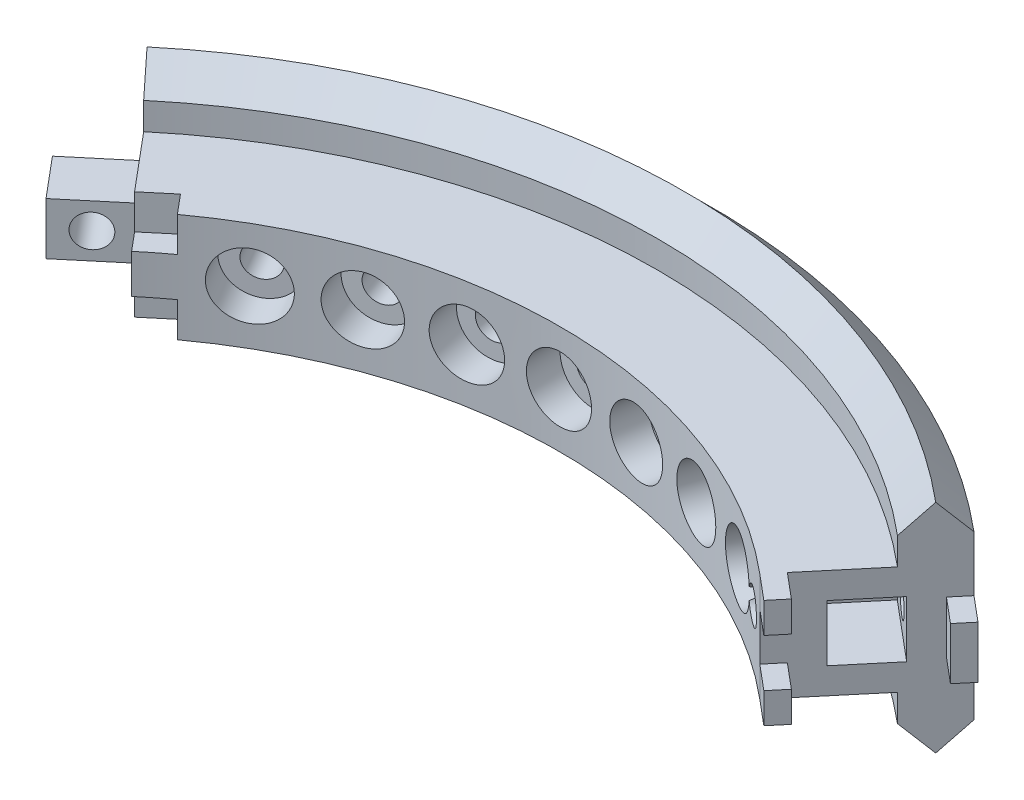
from build123d import *

# Parameters (mm, degrees)
REVOLVE_1_ANGLE          = 80
SKETCH_3_W               = 5.2
SKETCH_3_H               = 5.2
CUT_EXTRUDE_1_DEPTH      = 7
SKETCH_4_W               = 4.8
SKETCH_4_H               = 4.8
EXTRUDE_1_DEPTH          = 6
CUT_EXTRUDE_2_DEPTH      = 76.058901975
CUT_EXTRUDE_2_DEPTH_BACK = 76.058901975
SKETCH_5_R               = 1.5
CUT_EXTRUDE_START        = -1
SKETCH_6_R               = 3
CUT_EXTRUDE_3_DEPTH      = 77.259810408
SKETCH_7_R               = 1.5
CUT_EXTRUDE_4_DEPTH      = 76.587642406
SKETCH_11_R              = 1.5
CUT_EXTRUDE_6_DEPTH      = 48.784606194
CUT_EXTRUDE_7_DEPTH      = 5
SKETCH_13_W              = 3
SKETCH_13_H              = 5.021003204
PATTERN_CIRCULAR_1_COUNT = 4
PATTERN_CIRCULAR_1_ANGLE = 30
F_1_THE_OTHER_WAY_COUNT  = 4
F_1_THE_OTHER_WAY_ANGLE  = 30
SKETCH_9_W               = 1.8
SKETCH_9_H               = 4.8
SKETCH_9_H_2             = 2.8
EXTRUDE_2_DEPTH          = 3
SKETCH_10_W              = 2.2
SKETCH_10_H              = 5.2
CUT_EXTRUDE_5_DEPTH      = 3


# Read off the part's stored shape, not the designer's step: 旋转1
with BuildPart() as part:
    # 旋转1 outline → 旋转1 (revolve)
    with BuildSketch(Plane(origin=(0, 0, 0), x_dir=(0.6427876096865408, 0, -0.7660444431189768), z_dir=(0.7660444431189768, 0, 0.6427876096865408))):
        Polygon((54, 5), (45, 5), (45, -5), (54, -5), (54, -7.5), (56.5, -10), (59, -7.5), (59, 7.5), (56.5, 10), (54, 7.5), align=None)
    revolve(axis=Axis((0, 0, 0), (0, 1, 0)), revolution_arc=REVOLVE_1_ANGLE)

    # 草图3 → 切除-拉伸1 (cut)
    with BuildSketch(Plane(origin=(0, 0, 0), x_dir=(0.6427876096865405, 0, -0.766044443118977), z_dir=(0.7660444431189771, 0, 0.6427876096865406))):
        with Locations((52, 0)):
            Rectangle(SKETCH_3_W, SKETCH_3_H)
    extrude(amount=-CUT_EXTRUDE_1_DEPTH, mode=Mode.SUBTRACT)

    # 草图4 → 凸台-拉伸1 (add)
    with BuildSketch(Plane(origin=(0, 0, 0), x_dir=(0.6427876096865351, 0, 0.7660444431189817), z_dir=(-0.7660444431189817, 0, 0.6427876096865351))):
        with Locations((-52, 0)):
            Rectangle(SKETCH_4_W, SKETCH_4_H)
    extrude(amount=EXTRUDE_1_DEPTH)

    # 草图5 → 切除-拉伸2 (cut, two sides: drawn at the far end of the back side and taken through both)
    with BuildSketch(Plane(origin=(31.753707919, 0, -37.84259549), x_dir=(-0.7660444431189772, 0, -0.6427876096865404), z_dir=(0.6427876096865404, 0, -0.7660444431189772)).offset(-CUT_EXTRUDE_2_DEPTH_BACK)):
        with Locations((3.5, 0)):
            Circle(SKETCH_5_R)
    extrude(amount=CUT_EXTRUDE_2_DEPTH + CUT_EXTRUDE_2_DEPTH_BACK, mode=Mode.SUBTRACT)

    # 草图6 → 切除-拉伸3 (cut, through all)
    with BuildSketch(Plane(origin=(35.096203489, 0, -41.826026594), x_dir=(0.7660444431189772, 0, 0.6427876096865404), z_dir=(-0.6427876096865404, 0, 0.7660444431189772)).offset(CUT_EXTRUDE_START)):
        with Locations((-3.5, 0)):
            Circle(SKETCH_6_R)
    extrude(amount=-CUT_EXTRUDE_3_DEPTH, mode=Mode.SUBTRACT)

    # 草图7 → 切除-拉伸4 (cut, through all)
    with BuildSketch(Plane(origin=(-34.967645967, 0, -41.672817706), x_dir=(-0.7660444431189816, 0, 0.6427876096865353), z_dir=(-0.6427876096865353, 0, -0.7660444431189816))):
        with Locations((3, 0)):
            Circle(SKETCH_7_R)
    extrude(amount=-CUT_EXTRUDE_4_DEPTH, mode=Mode.SUBTRACT)

    # 草图11 → 切除-拉伸6 (cut, through all)
    with BuildSketch(Plane(origin=(0, 0, -59), x_dir=(-1, 0, 0), z_dir=(0, 0, -1))):
        Circle(SKETCH_11_R)
    cut_extrude_6 = extrude(amount=-CUT_EXTRUDE_6_DEPTH, mode=Mode.SUBTRACT)

    # 草图12 → 切除-拉伸7 (cut)
    with BuildSketch(Plane(origin=(0, 0, -59), x_dir=(-1, 0, 0), z_dir=(0, 0, -1))):
        Polygon((0, 3.175426481), (-2.75, 1.58771324), (-2.75, -1.58771324), (0, -3.175426481), (2.75, -1.58771324), (2.75, 1.58771324), align=None)
    cut_extrude_7 = extrude(amount=-CUT_EXTRUDE_7_DEPTH, mode=Mode.SUBTRACT)

    # 草图13 → 切除-旋转3 (revolve, cut)
    with BuildSketch(Plane(origin=(0, 0, 0), x_dir=(1, 0, 0), z_dir=(0, 1, 0)), mode=Mode.PRIVATE) as cut_revolve_3_sk:
        with Locations((1.5, 45.489498398)):
            Rectangle(SKETCH_13_W, SKETCH_13_H)
    cut_revolve_3 = revolve(cut_revolve_3_sk.sketch.rotate(Axis((0, 0, 999.855334811), (0, 0, -1)), 180), axis=Axis((0, 0, 999.855334811), (0, 0, -1)), mode=Mode.SUBTRACT)

    # 阵列(圆周)1: 切除-拉伸6, 切除-拉伸7, 切除-旋转3 ×4 about axis
    pattern_circular_1_axis = Axis((0, 0, 0), (0, 1, 0))
    add([cut_extrude_6.rotate(pattern_circular_1_axis, i * PATTERN_CIRCULAR_1_ANGLE / (PATTERN_CIRCULAR_1_COUNT - 1)) for i in range(1, PATTERN_CIRCULAR_1_COUNT)], mode=Mode.SUBTRACT)
    add([cut_extrude_7.rotate(pattern_circular_1_axis, i * PATTERN_CIRCULAR_1_ANGLE / (PATTERN_CIRCULAR_1_COUNT - 1)) for i in range(1, PATTERN_CIRCULAR_1_COUNT)], mode=Mode.SUBTRACT)
    add([cut_revolve_3.rotate(pattern_circular_1_axis, i * PATTERN_CIRCULAR_1_ANGLE / (PATTERN_CIRCULAR_1_COUNT - 1)) for i in range(1, PATTERN_CIRCULAR_1_COUNT)], mode=Mode.SUBTRACT)

    # 1 the other way: 切除-拉伸6, 切除-拉伸7, 切除-旋转3 ×4 about axis
    f_1_the_other_way_axis = Axis((0, 0, 0), (0, -1, 0))
    add([cut_extrude_6.rotate(f_1_the_other_way_axis, i * F_1_THE_OTHER_WAY_ANGLE / (F_1_THE_OTHER_WAY_COUNT - 1)) for i in range(1, F_1_THE_OTHER_WAY_COUNT)], mode=Mode.SUBTRACT)
    add([cut_extrude_7.rotate(f_1_the_other_way_axis, i * F_1_THE_OTHER_WAY_ANGLE / (F_1_THE_OTHER_WAY_COUNT - 1)) for i in range(1, F_1_THE_OTHER_WAY_COUNT)], mode=Mode.SUBTRACT)
    add([cut_revolve_3.rotate(f_1_the_other_way_axis, i * F_1_THE_OTHER_WAY_ANGLE / (F_1_THE_OTHER_WAY_COUNT - 1)) for i in range(1, F_1_THE_OTHER_WAY_COUNT)], mode=Mode.SUBTRACT)

    # 草图9 → 凸台-拉伸2 (add)
    with BuildSketch(Plane(origin=(0, 0, 0), x_dir=(0.6427876096865405, 0, -0.7660444431189771), z_dir=(0.7660444431189771, 0, 0.6427876096865405))):
        with Locations((58.1, 0)):
            Rectangle(SKETCH_9_W, SKETCH_9_H)
        with Locations((45.9, 3.6)):
            Rectangle(SKETCH_9_W, SKETCH_9_H_2)
        with Locations((45.9, -3.6)):
            Rectangle(SKETCH_9_W, SKETCH_9_H_2)
    extrude(amount=EXTRUDE_2_DEPTH)

    # 草图10 → 切除-拉伸5 (cut)
    with BuildSketch(Plane(origin=(0, 0, 0), x_dir=(0.6427876096865351, 0, 0.7660444431189817), z_dir=(-0.7660444431189817, 0, 0.6427876096865351))):
        with Locations((-57.9, 0)):
            Rectangle(SKETCH_10_W, SKETCH_10_H)
        Polygon((-47.2, 5), (-45, 5), (-43, 5), (-43, 1.8), (-45, 1.8), (-47.2, 1.8), align=None)
        Polygon((-47.2, -1.8), (-45, -1.8), (-43, -1.8), (-43, -5), (-45, -5), (-47.2, -5), align=None)
    extrude(amount=-CUT_EXTRUDE_5_DEPTH, mode=Mode.SUBTRACT)


solid = part.part
